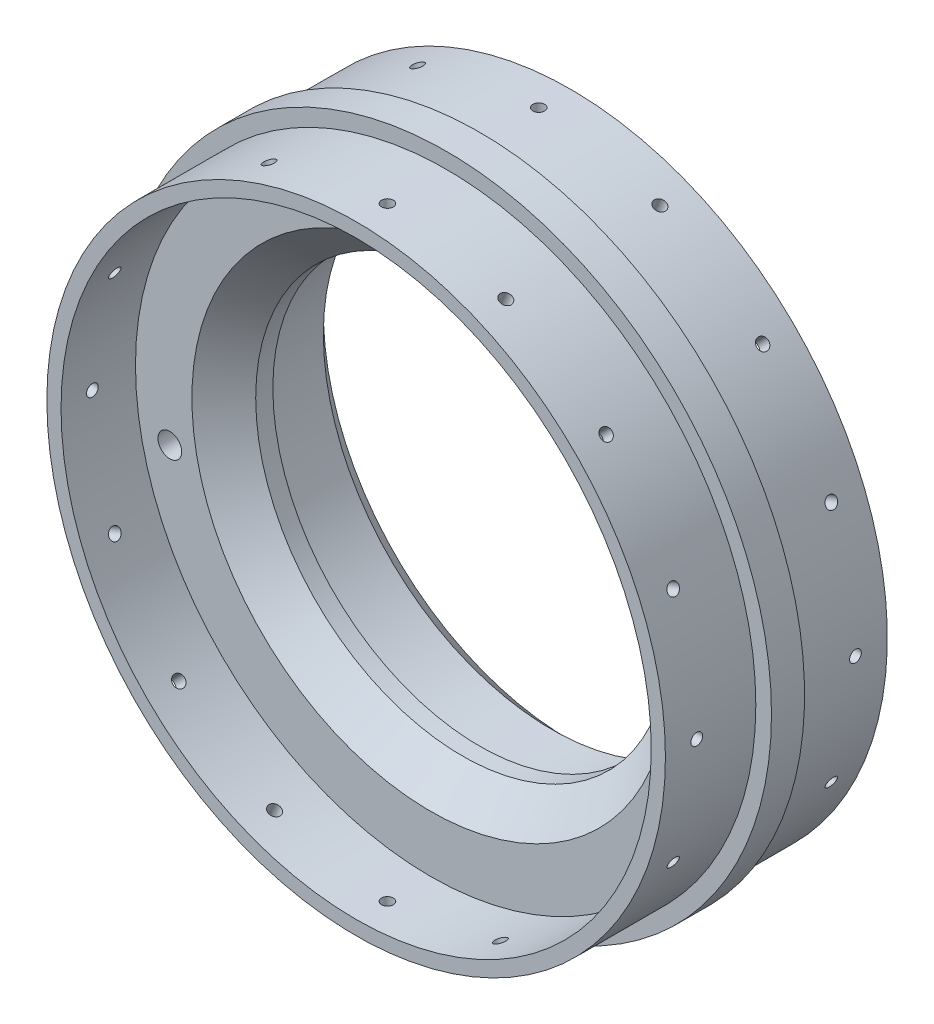
from build123d import *

# Parameters (mm, degrees)
SKETCH5_R                       = 69.85
EXTRUDE1_DEPTH                  = 46.101
SKETCH8_R                       = 44.45
EXTRUDE4_DEPTH                  = 110.010766445
SKETCH6_OUTSIDE_W               = 182.274
SKETCH6_OUTSIDE_H               = 182.274
SKETCH6_OUTSIDE_R               = 66.4845
EXTRUDE2_DEPTH                  = 19.431
SKETCH7_R                       = 63.4365
EXTRUDE3_DEPTH                  = 16.002
CHAMFER1_SIZE                   = 6.858
SKETCH9_OUTSIDE_W               = 182.274
SKETCH9_OUTSIDE_H               = 182.274
SKETCH9_OUTSIDE_R               = 68.0847
EXTRUDE5_DEPTH                  = 19.558
SKETCH10_R                      = 65.0367
SKETCH10_R_2                    = 53.7845
EXTRUDE6_DEPTH                  = 9.525
SKETCH11_R                      = 49.0855
EXTRUDE7_DEPTH                  = 19.558
CHAMFER2_SIZE                   = 4.064
CIRPATTERN1_COUNT               = 16
F_21_0_159_DIAMETER_HOLE1_D     = 4.0386
F_21_0_159_DIAMETER_HOLE1_DEPTH = 12.7
F_21_0_159_DIAMETER_HOLE1_TIP   = 1.213317848
F_7_0_201_DIAMETER_HOLE1_D      = 5.1054
CIRPATTERN2_COUNT               = 2


with BuildPart() as part:
    # Sketch5 → Extrude1 (new body)
    with BuildSketch(Plane.XY):
        Circle(SKETCH5_R)
    extrude(amount=EXTRUDE1_DEPTH)

    # Sketch8 → Extrude4 (cut, through all)
    with BuildSketch(Plane.XY.offset(46.101)):
        Circle(SKETCH8_R)
    extrude(amount=-EXTRUDE4_DEPTH, mode=Mode.SUBTRACT)

    # Sketch6 outside → Extrude2 (cut)
    with BuildSketch(Plane.XY.offset(46.101)):
        Rectangle(SKETCH6_OUTSIDE_W, SKETCH6_OUTSIDE_H)
        Circle(SKETCH6_OUTSIDE_R, mode=Mode.SUBTRACT)
    extrude(amount=-EXTRUDE2_DEPTH, mode=Mode.SUBTRACT)

    # Sketch7 → Extrude3 (cut)
    with BuildSketch(Plane.XY.offset(46.101)):
        Circle(SKETCH7_R)
    extrude(amount=-EXTRUDE3_DEPTH, mode=Mode.SUBTRACT)

    # Chamfer1
    chamfer1_edges = [part.edges().sort_by_distance(p)[0] for p in [
        (-44.45, 0, 30.099),
    ]]
    chamfer(chamfer1_edges, length=CHAMFER1_SIZE)

    # Sketch9 outside → Extrude5 (cut)
    with BuildSketch(Plane(origin=(0, 0, 0), x_dir=(-1, 0, 0), z_dir=(0, 0, -1))):
        Rectangle(SKETCH9_OUTSIDE_W, SKETCH9_OUTSIDE_H)
        Circle(SKETCH9_OUTSIDE_R, mode=Mode.SUBTRACT)
    extrude(amount=-EXTRUDE5_DEPTH, mode=Mode.SUBTRACT)

    # Sketch10 → Extrude6 (cut)
    with BuildSketch(Plane(origin=(0, 0, 0), x_dir=(-1, 0, 0), z_dir=(0, 0, -1))):
        Circle(SKETCH10_R)
        Circle(SKETCH10_R_2, mode=Mode.SUBTRACT)
    extrude(amount=-EXTRUDE6_DEPTH, mode=Mode.SUBTRACT)

    # Sketch11 → Extrude7 (cut)
    with BuildSketch(Plane(origin=(0, 0, 0), x_dir=(-1, 0, 0), z_dir=(0, 0, -1))):
        Circle(SKETCH11_R)
    extrude(amount=-EXTRUDE7_DEPTH, mode=Mode.SUBTRACT)

    # Chamfer2
    chamfer2_edges = [part.edges().sort_by_distance(p)[0] for p in [
        (49.0855, 0, 0),
    ]]
    chamfer(chamfer2_edges, length=CHAMFER2_SIZE)

    # Sketch19 → #39 (0.0995) Diameter Hole2 (revolve, cut)
    with BuildSketch(Plane(origin=(0, 68.0847, 6.858), x_dir=(0, 0, 1), z_dir=(1, 0, 0))):
        Polygon((0, 0), (0, 13.459277521), (1.26365, 12.7), (1.26365, 0), align=None)
    f_39_0_0995_diameter_hole2 = revolve(axis=Axis((0, 74.4347, 6.858), (0, -1, 0)), mode=Mode.SUBTRACT)

    # Sketch25 → #39 (0.0995) Diameter Hole6 (revolve, cut)
    with BuildSketch(Plane(origin=(0, 66.4845, 39.37), x_dir=(0, 0, 1), z_dir=(1, 0, 0))):
        Polygon((0, 0), (0, 13.459277521), (1.26365, 12.7), (1.26365, 0), align=None)
    f_39_0_0995_diameter_hole6 = revolve(axis=Axis((0, 72.8345, 39.37), (0, -1, 0)), mode=Mode.SUBTRACT)

    # CirPattern1: #39 (0.0995) Diameter Hole2, #39 (0.0995) Diameter Hole6 ×16 about axis
    cirpattern1_axis = Axis((0, 0, 19.558), (0, 0, -1))
    add([f_39_0_0995_diameter_hole2.rotate(cirpattern1_axis, i * 360 / CIRPATTERN1_COUNT) for i in range(1, CIRPATTERN1_COUNT)], mode=Mode.SUBTRACT)
    add([f_39_0_0995_diameter_hole6.rotate(cirpattern1_axis, i * 360 / CIRPATTERN1_COUNT) for i in range(1, CIRPATTERN1_COUNT)], mode=Mode.SUBTRACT)

    # #21 (0.159) Diameter Hole1
    with Locations(Plane(origin=(13.627058993, -68.507851836, 23.114), x_dir=(0.9807852804032304, 0.19509032201612872, 0), z_dir=(0.1950903220161287, -0.9807852804032303, 0))):
        with Locations((0, 0)):
            Hole(F_21_0_159_DIAMETER_HOLE1_D / 2, depth=F_21_0_159_DIAMETER_HOLE1_DEPTH)
            with Locations((0, 0, -(F_21_0_159_DIAMETER_HOLE1_DEPTH + F_21_0_159_DIAMETER_HOLE1_TIP / 2))):  # 118° drill point
                Cone(0, F_21_0_159_DIAMETER_HOLE1_D / 2, F_21_0_159_DIAMETER_HOLE1_TIP, mode=Mode.SUBTRACT)

    # #7 (0.201) Diameter Hole1 (through all)
    with Locations(Plane(origin=(56.051878775, 11.149411903, 30.099), x_dir=(1, 0, 0), z_dir=(0, 0, 1))):
        with Locations((0, 0)):
            f_7_0_201_diameter_hole1 = Hole(F_7_0_201_DIAMETER_HOLE1_D / 2)

    # CirPattern2: #7 (0.201) Diameter Hole1 ×2 about axis
    cirpattern2_axis = Axis((0, 0, 26.67), (0, 0, 1))
    for i in range(1, CIRPATTERN2_COUNT):
        add(f_7_0_201_diameter_hole1.rotate(cirpattern2_axis, i * 360 / CIRPATTERN2_COUNT), mode=Mode.SUBTRACT)


solid = part.part
